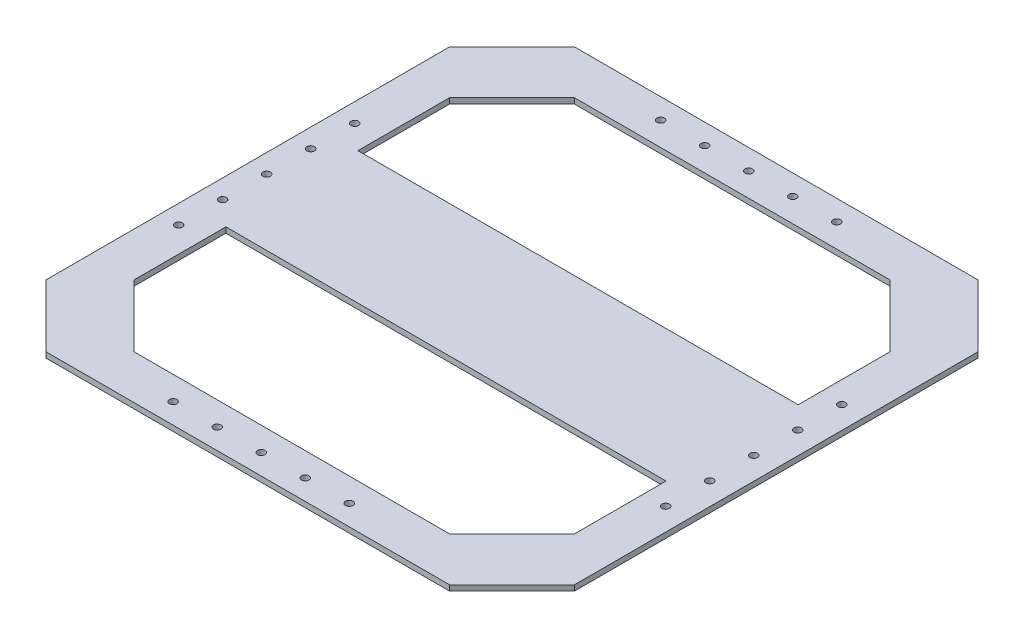
from build123d import *

# Parameters (mm, degrees)
BOSS_EXTRUDE1_DEPTH = 3.175
CUT_EXTRUDE1_DEPTH  = 255.438962357
SKETCH4_R           = 2.159
CUT_EXTRUDE2_DEPTH  = 255.438962357


with BuildPart() as part:
    # Sketch1 → Boss-Extrude1 (new body)
    with BuildSketch(Plane(origin=(0, 0, 0), x_dir=(1, 0, 0), z_dir=(0, 1, 0))):
        Polygon((-148.336, 68.259630377), (-112.414975516, 104.180654861), (120.542975516, 104.180654861), (156.464, 68.259630377), (156.464, -164.698320655), (120.542975516, -200.619345139), (-112.414975516, -200.619345139), (-148.336, -164.698320655), align=None)
    extrude(amount=BOSS_EXTRUDE1_DEPTH)

    # Sketch2 → Cut-Extrude1 (cut, through all)
    with BuildSketch(Plane(origin=(0, 3.175, 0), x_dir=(1, 0, 0), z_dir=(0, 1, 0))):
        Polygon((-87.014975516, 78.780654861), (95.142975516, 78.780654861), (131.064, 42.859630377), (131.064, -10.119345139), (82.442975516, -10.119345139), (-74.314975516, -10.119345139), (-122.936, -10.119345139), (-122.936, 42.859630377), align=None)
        Polygon((131.064, -139.298320655), (95.142975516, -175.219345139), (-87.014975516, -175.219345139), (-122.936, -139.298320655), (-122.936, -86.319345139), (-74.314975516, -86.319345139), (82.442975516, -86.319345139), (131.064, -86.319345139), align=None)
    extrude(amount=-CUT_EXTRUDE1_DEPTH, mode=Mode.SUBTRACT)

    # Sketch4 → Cut-Extrude2 (cut, through all)
    with BuildSketch(Plane(origin=(0, 3.175, 0), x_dir=(1, 0, 0), z_dir=(0, 1, 0))):
        with Locations((0, 92.427834136)):
            Circle(SKETCH4_R)
        with Locations((-50.8, 92.427834136)):
            Circle(SKETCH4_R)
        with Locations((50.8, 92.427834136)):
            Circle(SKETCH4_R)
        with Locations((-25.4, 92.427834136)):
            Circle(SKETCH4_R)
        with Locations((25.4, 92.427834136)):
            Circle(SKETCH4_R)
        with Locations((-137.491054253, -48.219345139)):
            Circle(SKETCH4_R)
        with Locations((-137.491054253, -22.819345139)):
            Circle(SKETCH4_R)
        with Locations((-137.491054253, 2.580654861)):
            Circle(SKETCH4_R)
        with Locations((143.542013637, -48.219345139)):
            Circle(SKETCH4_R)
        with Locations((143.542013637, -22.819345139)):
            Circle(SKETCH4_R)
        with Locations((143.542013637, 2.580654861)):
            Circle(SKETCH4_R)
        with Locations((143.542013637, -99.019345139)):
            Circle(SKETCH4_R)
        with Locations((143.542013637, -73.619345139)):
            Circle(SKETCH4_R)
        with Locations((-137.491054253, -99.019345139)):
            Circle(SKETCH4_R)
        with Locations((-137.491054253, -73.619345139)):
            Circle(SKETCH4_R)
        with Locations((25.4, -188.866524415)):
            Circle(SKETCH4_R)
        with Locations((-25.4, -188.866524415)):
            Circle(SKETCH4_R)
        with Locations((50.8, -188.866524415)):
            Circle(SKETCH4_R)
        with Locations((-50.8, -188.866524415)):
            Circle(SKETCH4_R)
        with Locations((0, -188.866524415)):
            Circle(SKETCH4_R)
    extrude(amount=-CUT_EXTRUDE2_DEPTH, mode=Mode.SUBTRACT)


solid = part.part
